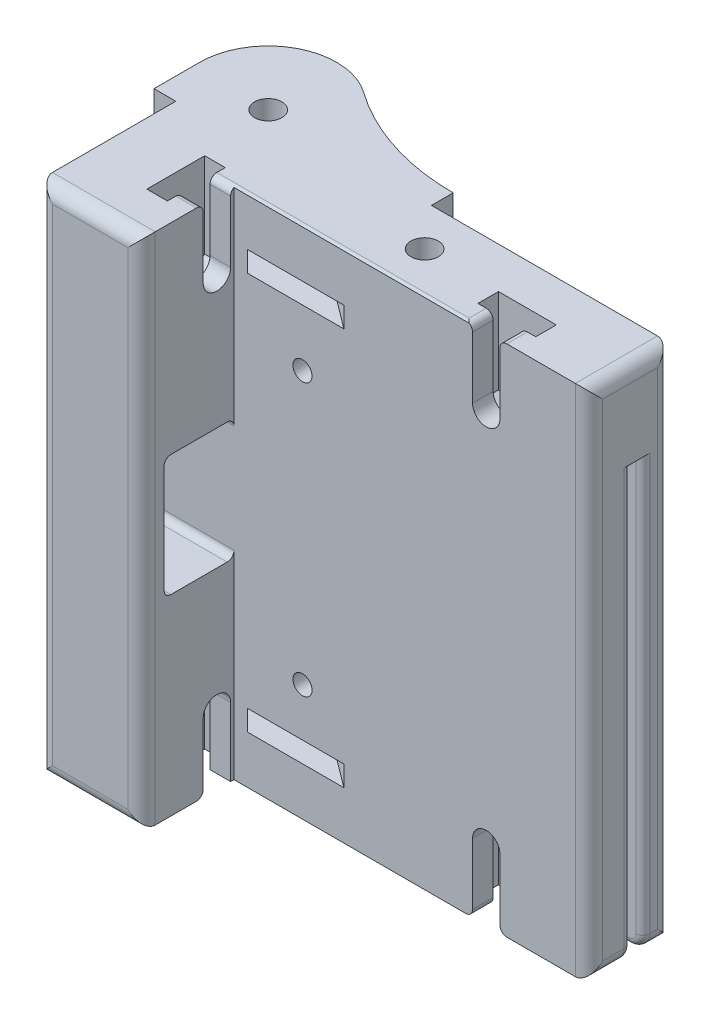
from build123d import *

# Parameters (mm, degrees)
BOSS_EXTRUDE1_DEPTH = 75
SKETCH2_R           = 2
CUT_EXTRUDE1_DEPTH  = 15
SKETCH4_R           = 2
CUT_EXTRUDE2_DEPTH  = 12
SKETCH3_R           = 2
CUT_EXTRUDE3_DEPTH  = 75
CUT_EXTRUDE4_START  = -3
CUT_EXTRUDE4_DEPTH  = 3
CUT_EXTRUDE5_START  = -3
CUT_EXTRUDE5_DEPTH  = 3
CUT_EXTRUDE6_START  = -3
CUT_EXTRUDE6_DEPTH  = 3
CUT_EXTRUDE7_START  = -3
CUT_EXTRUDE7_DEPTH  = 3
CUT_EXTRUDE12_START = -7
CUT_EXTRUDE12_DEPTH = 3
CUT_EXTRUDE14_START = -7
CUT_EXTRUDE14_DEPTH = 3
FILLET2_START       = 9
FILLET2_DEPTH       = 4.666666667
FILLET2_START_2     = 4
FILLET2_2_DEPTH     = 39
FILLET3_R           = 2
SKETCH10_W          = 1.75
SKETCH10_H          = 62.75
CUT_EXTRUDE9_DEPTH  = 5
FILLET4_R           = 1
SKETCH11_W          = 10.2
SKETCH11_H          = 17.7
CUT_EXTRUDE10_DEPTH = 15
SKETCH12_R          = 1.397
CUT_EXTRUDE11_DEPTH = 10
FILLET5_R           = 1


with BuildPart() as part:
    # Sketch1 → Boss-Extrude1 (new body)
    with BuildSketch(Plane(origin=(0, 0, 0), x_dir=(1, 0, 0), z_dir=(0, 1, 0))):
        with BuildLine():
            Line((-6.825, -6.666666667), (-6.825, -26.666666667))
            Line((-6.825, -26.666666667), (8.175, -26.666666667))
            Line((8.175, -26.666666667), (8.175, -13.175))
            Line((8.175, -13.175), (60, -13.175))
            Line((60, -13.175), (60, -1.175))
            Line((60, -1.175), (25, -1.175))
            Line((25, -1.175), (25, 2))
            ThreePointArc((25, 2), (14.923352523, 3.572976633), (5.805515239, 8.142235123))
            ThreePointArc((5.805515239, 8.142235123), (3.047757271, 9.524241472), (0, 10))
            ThreePointArc((0, 10), (-7.071067812, 7.071067812), (-10, 0))
            Line((-10, 0), (-10, -6.666666667))
            Line((-10, -6.666666667), (-6.825, -6.666666667))
        make_face()
    extrude(amount=BOSS_EXTRUDE1_DEPTH)

    # Sketch2 → Cut-Extrude1 (cut)
    with BuildSketch(Plane.ZY.offset(6.825)):
        with Locations((15.666666667, 65)):
            Circle(SKETCH2_R)
    cut_extrude1 = extrude(amount=-CUT_EXTRUDE1_DEPTH, mode=Mode.SUBTRACT)

    # Sketch4 → Cut-Extrude2 (cut)
    with BuildSketch(Plane(origin=(0, 0, 1.175), x_dir=(-1, 0, 0), z_dir=(0, 0, -1))):
        with Locations((-45, 65)):
            Circle(SKETCH4_R)
    cut_extrude2 = extrude(amount=-CUT_EXTRUDE2_DEPTH, mode=Mode.SUBTRACT)

    # Sketch3 → Cut-Extrude3 (cut)
    with BuildSketch(Plane(origin=(0, 75, 0), x_dir=(1, 0, 0), z_dir=(0, 1, 0))):
        with Locations(Location((1, -1, 0), (0, 0, 270))):
            Circle(SKETCH3_R)
        with Locations(Location((30, -7.175, 0), (0, 0, 270))):
            Circle(SKETCH3_R)
    extrude(amount=-CUT_EXTRUDE3_DEPTH, mode=Mode.SUBTRACT)

    # Sketch5 → Cut-Extrude4 (cut)
    with BuildSketch(Plane(origin=(8.175, 0, 0), x_dir=(0, 0, -1), z_dir=(1, 0, 0)).offset(CUT_EXTRUDE4_START)):
        Polygon((-19.885416667, 62.564303552), (-15.666666667, 60.128607104), (-11.447916667, 62.564303552), (-11.447916667, 75), (-19.885416667, 75), align=None)
    cut_extrude4 = extrude(amount=-CUT_EXTRUDE4_DEPTH, mode=Mode.SUBTRACT)

    # Sketch6 → Cut-Extrude5 (cut)
    with BuildSketch(Plane(origin=(8.175, 0, 0), x_dir=(0, 0, -1), z_dir=(1, 0, 0)).offset(CUT_EXTRUDE5_START)):
        with BuildLine():
            Line((-13.666666667, 65), (-13.666666667, 75))
            Line((-13.666666667, 75), (-17.666666667, 75))
            Line((-17.666666667, 75), (-17.666666667, 65))
            ThreePointArc((-17.666666667, 65), (-15.666666667, 67), (-13.666666667, 65))
        make_face()
    cut_extrude5 = extrude(amount=CUT_EXTRUDE5_DEPTH, mode=Mode.SUBTRACT)

    # Sketch7 → Cut-Extrude6 (cut)
    with BuildSketch(Plane.XY.offset(13.175).offset(CUT_EXTRUDE6_START)):
        Polygon((40.78125, 62.564303552), (45, 60.128607104), (49.21875, 62.564303552), (49.21875, 75), (40.78125, 75), align=None)
    cut_extrude6 = extrude(amount=-CUT_EXTRUDE6_DEPTH, mode=Mode.SUBTRACT)

    # Sketch8 → Cut-Extrude7 (cut)
    with BuildSketch(Plane.XY.offset(13.175).offset(CUT_EXTRUDE7_START)):
        with BuildLine():
            Line((47, 65), (47, 75))
            Line((47, 75), (43, 75))
            Line((43, 75), (43, 65))
            ThreePointArc((43, 65), (45, 67), (47, 65))
        make_face()
    cut_extrude7 = extrude(amount=CUT_EXTRUDE7_DEPTH, mode=Mode.SUBTRACT)

    # Sketch13 → Cut-Extrude12 (cut)
    with BuildSketch(Plane.XZ.offset(CUT_EXTRUDE12_START)):
        Polygon((-2.893869279, -1.927157459), (1.588058081, -3.835768444), (5.48192736, -0.908610985), (24.216737808, 13.175), (10.175, 13.175), (0.411941919, 5.835768444), (-3.48192736, 2.908610985), align=None)
    cut_extrude12 = extrude(amount=-CUT_EXTRUDE12_DEPTH, mode=Mode.SUBTRACT)

    # Sketch16 → Cut-Extrude14 (cut)
    with BuildSketch(Plane(origin=(0, 75, 0), x_dir=(1, 0, 0), z_dir=(0, 1, 0)).offset(CUT_EXTRUDE14_START)):
        Polygon((25.78125, -4.739303552), (25.78125, -1.175), (34.21875, -1.175), (34.21875, -4.739303552), (34.21875, -9.610696448), (30, -12.046392896), (25.78125, -9.610696448), align=None)
    cut_extrude14 = extrude(amount=-CUT_EXTRUDE14_DEPTH, mode=Mode.SUBTRACT)

    # Mirror2: Cut-Extrude1, Cut-Extrude2, Cut-Extrude4, Cut-Extrude5, Cut-Extrude6, Cut-Extrude7, Cut-Extrude12, Cut-Extrude14 across plane
    add(cut_extrude1.mirror(Plane.ZX.offset(37.5)), mode=Mode.SUBTRACT)
    add(cut_extrude2.mirror(Plane.ZX.offset(37.5)), mode=Mode.SUBTRACT)
    add(cut_extrude4.mirror(Plane.ZX.offset(37.5)), mode=Mode.SUBTRACT)
    add(cut_extrude5.mirror(Plane.ZX.offset(37.5)), mode=Mode.SUBTRACT)
    add(cut_extrude6.mirror(Plane.ZX.offset(37.5)), mode=Mode.SUBTRACT)
    add(cut_extrude7.mirror(Plane.ZX.offset(37.5)), mode=Mode.SUBTRACT)
    add(cut_extrude12.mirror(Plane.ZX.offset(37.5)), mode=Mode.SUBTRACT)
    add(cut_extrude14.mirror(Plane.ZX.offset(37.5)), mode=Mode.SUBTRACT)

    # Fillet2: read off the stored shape, not the designer's step
    # Fillet2 outline → Fillet2 (cut)
    with BuildSketch(Plane.XY.offset(FILLET2_START)):
        with BuildLine():
            Line((47, 1), (47, 0))
            Line((47, 0), (48, 0))
            ThreePointArc((48, 0), (47.292893219, 0.292893219), (47, 1))
        make_face()
        with BuildLine():
            Line((48, 75), (47, 75))
            Line((47, 75), (47, 74))
            ThreePointArc((47, 74), (47.292893219, 74.707106781), (48, 75))
        make_face()
        with BuildLine():
            Line((43, 75), (42, 75))
            ThreePointArc((42, 75), (42.707106781, 74.707106781), (43, 74))
            Line((43, 74), (43, 75))
        make_face()
        with BuildLine():
            ThreePointArc((43, 1), (42.707106781, 0.292893219), (42, 0))
            Line((42, 0), (43, 0))
            Line((43, 0), (43, 1))
        make_face()
    extrude(amount=FILLET2_DEPTH, mode=Mode.SUBTRACT)

    # Fillet2 2 outline → Fillet2 2 (cut)
    with BuildSketch(Plane.YZ.offset(FILLET2_START_2)):
        with BuildLine():
            Line((74, 17.666666667), (75, 17.666666667))
            Line((75, 17.666666667), (75, 18.666666667))
            ThreePointArc((75, 18.666666667), (74.707106782, 17.959559886), (74, 17.666666667))
        make_face()
        with BuildLine():
            ThreePointArc((74, 13.666666667), (74.707106781, 13.373773448), (75, 12.666666667))
            Line((75, 12.666666667), (75, 13.666666667))
            Line((75, 13.666666667), (74, 13.666666667))
        make_face()
        with BuildLine():
            ThreePointArc((1, 17.666666667), (0.292893218, 17.959559886), (0, 18.666666667))
            Line((0, 18.666666667), (0, 17.666666667))
            Line((0, 17.666666667), (1, 17.666666667))
        make_face()
    extrude(amount=FILLET2_2_DEPTH, mode=Mode.SUBTRACT)

    # Fillet3
    fillet3_edges = [part.edges().sort_by_distance(p)[0] for p in [
        (60, 0, 7.175),
        (0.675, 0, 26.666666667),
        (60, 37.5, 1.175),
        (60, 37.5, 13.175),
        (8.175, 37.5, 26.666666667),
        (-6.825, 37.5, 26.666666667),
        (0.675, 75, 26.666666667),
        (60, 75, 7.175),
    ]]
    fillet(fillet3_edges, radius=FILLET3_R)

    # Sketch10 → Cut-Extrude9 (cut)
    with BuildSketch(Plane(origin=(60, 0, 0), x_dir=(0, 0, -1), z_dir=(1, 0, 0))):
        with Locations((-6.175, 31.375)):
            Rectangle(SKETCH10_W, SKETCH10_H)
    extrude(amount=-CUT_EXTRUDE9_DEPTH, mode=Mode.SUBTRACT)

    # Fillet4
    fillet4_edges = [part.edges().sort_by_distance(p)[0] for p in [
        (59.414213562, 0.585786438, 7.05),
        (59.414213562, 0.585786438, 5.3),
        (60, 32.375, 7.05),
        (60, 32.375, 5.3),
        (55, 0, 6.175),
        (56.5, 0, 5.3),
        (56.5, 0, 7.05),
    ]]
    fillet(fillet4_edges, radius=FILLET4_R)

    # Sketch11 → Cut-Extrude10 (cut)
    with BuildSketch(Plane(origin=(8.175, 0, 0), x_dir=(0, 0, -1), z_dir=(1, 0, 0))):
        with Locations((-18.275, 36.85)):
            Rectangle(SKETCH11_W, SKETCH11_H)
    extrude(amount=-CUT_EXTRUDE10_DEPTH, mode=Mode.SUBTRACT)

    # Sketch12 → Cut-Extrude11 (cut)
    with BuildSketch(Plane.XY.offset(13.175)):
        with Locations((18.175, 17)):
            Circle(SKETCH12_R)
        with Locations((18.175, 56.7)):
            Circle(SKETCH12_R)
    extrude(amount=-CUT_EXTRUDE11_DEPTH, mode=Mode.SUBTRACT)

    # Fillet5
    fillet5_edges = [part.edges().sort_by_distance(p)[0] for p in [
        (0.675, 45.7, 13.175),
        (0.675, 28, 13.175),
        (0.675, 28, 23.375),
        (0.675, 45.7, 23.375),
    ]]
    fillet(fillet5_edges, radius=FILLET5_R)


solid = part.part
